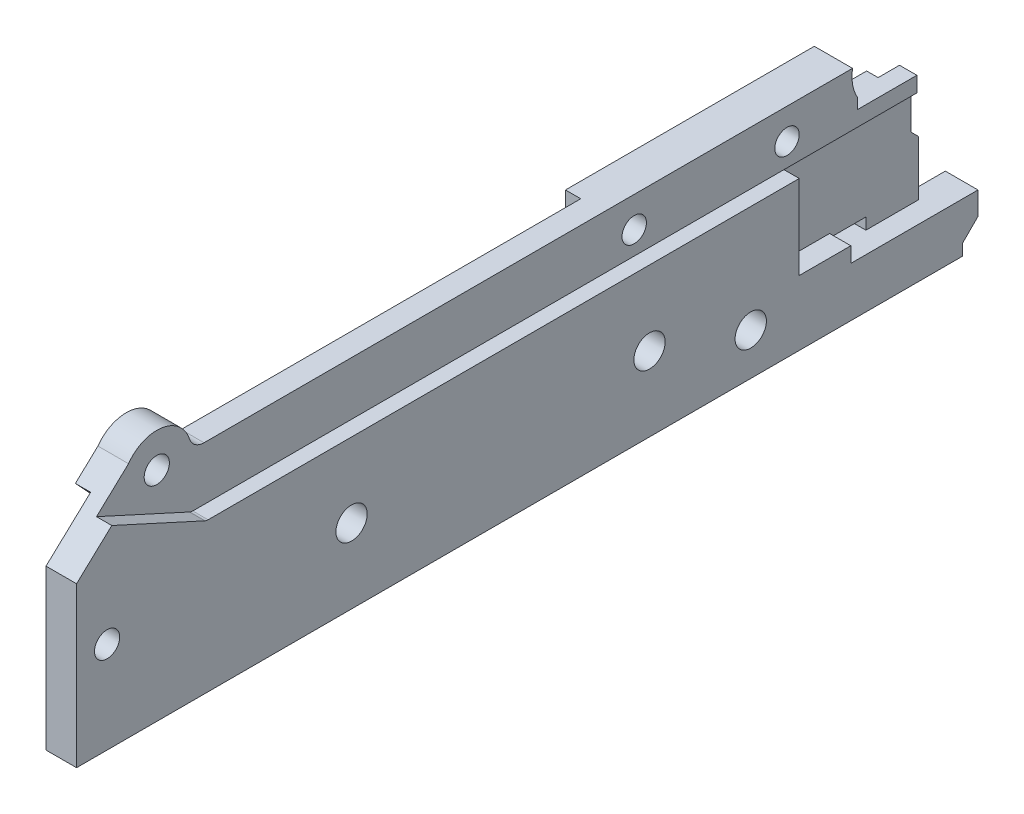
from build123d import *
from build123d.topology import SkipClean

# Parameters (mm, degrees)
SKETCH_1_R                       = 1.5999999999999999
SKETCH_1_R_2                     = 1.6000000000000016
EXTRUDE_1_DEPTH                  = 7
SKETCH_2_W                       = 33.199999999999996
SKETCH_2_H                       = 10.5
EXTRUDE_2_DEPTH                  = 2
EXTRUDE_3_DEPTH                  = 60
EXTRUDE_4_DEPTH                  = 38.5
SKETCH_5_W                       = 4.000000000000001
SKETCH_5_H                       = 10.499999999999998
EXTRUDE_5_DEPTH                  = 2
EXTRUDE_6_DEPTH                  = 19.5
EXTRUDE_7_DEPTH                  = 2
SKETCH_8_W                       = 93.19999999999999
SKETCH_8_H                       = 5
EXTRUDE_8_DEPTH                  = 3
SKETCH_10_W                      = 93.19999999999999
SKETCH_10_H                      = 1.9999999999999964
EXTRUDE_9_DEPTH                  = 5.5
SKETCH_12_W                      = 17.999999999999993
SKETCH_12_H                      = 1.9999999999999964
CUT_EXTRUDE_1_DEPTH              = 5.5
EXTRUDE_10_DEPTH                 = 3.5
CUT_EXTRUDE_2_REACH              = 70.879
EXTRUDE_12_DEPTH                 = 2
CUT_EXTRUDE_3_REACH              = 71.313
CHAMFER_1_SIZE                   = 3.5
SKETCH_18_R                      = 1.6500000000000001
EXTRUDE_13_DEPTH                 = 2
FILLET_1_R                       = 2
CUT_EXTRUDE_4_DEPTH              = 5
CHAMFER_2_SIZE                   = 3
CUT_EXTRUDE_5_REACH              = 74.561
SKETCH_20_R                      = 1.650000000000002
EXTRUDE_14_REACH                 = 73.895
SKETCH_21_R                      = 4.500000000000004
SKETCH_21_R_2                    = 1.6500000000000021
EXTRUDE_15_DEPTH                 = 6
EXTRUDE_16_DEPTH                 = 4
CUT_EXTRUDE_6_REACH              = 83.84
SKETCH_24_R                      = 1.6500000000000021
CUT_EXTRUDE_7_REACH              = 84.171
SKETCH_26_W                      = 1.9999999999999973
SKETCH_26_H                      = 10.5
CUT_EXTRUDE_8_DEPTH              = 5
SKETCH_27_W                      = 2.000000000000001
SKETCH_27_H                      = 1.9999999999999991
EXTRUDE_17_DEPTH                 = 10
CUT_EXTRUDE_9_DEPTH              = 2
CUT_EXTRUDE_10_REACH             = 84.426
SKETCH_29_R                      = 5.4999999999999964
SKETCH_30_W                      = 63
SKETCH_30_H                      = 2.000000000000001
EXTRUDE_18_DEPTH                 = 1
SKETCH_32_R                      = 1.6500000000000001
EXTRUDE_19_DEPTH                 = 0.775
EXTRUDE_20_DEPTH                 = 5.5
SKETCH_35_W                      = 4.9999999999999964
SKETCH_35_H                      = 9.999999999999998
CUT_EXTRUDE_12_DEPTH             = 1.225
EXTRUDE_21_DEPTH                 = 5
CUT_EXTRUDE_13_REACH             = 84.197
SKETCH_37_W                      = 4.75
SKETCH_37_H                      = 2.9999999999999982
CUT_EXTRUDE_13_DIRECTION_2_REACH = 84.197
CUT_EXTRUDE_14_REACH             = 84.197
CUT_EXTRUDE_14_DIRECTION_2_DEPTH = 1
EXTRUDE_22_DEPTH                 = 5.8
EXTRUDE_22_DIRECTION_2_REACH     = 116.063
SKETCH_40_W                      = 1.5000000000000004
SKETCH_40_H                      = 10
EXTRUDE_23_DEPTH                 = 5
CUT_EXTRUDE_15_REACH             = 84.085
SKETCH_41_W                      = 1
SKETCH_41_H                      = 7
CHAMFER_3_SIZE                   = 1
SKETCH_42_W                      = 2.775000000000003
SKETCH_42_H                      = 5.0000000000000036
EXTRUDE_24_DEPTH                 = 10.8
CUT_EXTRUDE_16_REACH             = 84.085
SKETCH_44_W                      = 9.799999999999997
SKETCH_44_H                      = 2.000000000000005
EXTRUDE_25_DEPTH                 = 2
SKETCH_45_W                      = 0.7999999999999972
SKETCH_45_H                      = 6.100000000000001
CUT_EXTRUDE_17_DEPTH             = 0.775
CUT_EXTRUDE_18_REACH             = 84.426
SKETCH_46_R                      = 2.0500000000000003
CUT_EXTRUDE_19_DEPTH             = 1
SKETCH_48_R                      = 2.0500000000000007
SKETCH_48_R_2                    = 2.0499999999999994
CUT_EXTRUDE_20_DEPTH             = 5
CUT_EXTRUDE_21_REACH             = 113.959
CUT_EXTRUDE_22_DEPTH             = 3
EXTRUDE_26_DEPTH                 = 14.5
EXTRUDE_27_DEPTH                 = 0.5
SKETCH_54_W                      = 28.68337520964458
SKETCH_54_H                      = 12.50000000000001
CUT_EXTRUDE_23_DEPTH             = 3
EXTRUDE_28_REACH                 = 83.879
FILLET_2_R                       = 0.8
EXTRUDE_START                    = -3.5
SKETCH_56_R                      = 3.999999999999999
SKETCH_56_R_2                    = 2.0500000000000007
EXTRUDE_29_DEPTH                 = 3.5
FILLET_3_R                       = 0.8
CUT_EXTRUDE_24_REACH             = 83.879
SKETCH_57_R                      = 2.0500000000000003
SKETCH_57_R_2                    = 2.0499999999999994
SKETCH_58_W                      = 15.200000000000006
SKETCH_58_H                      = 8.500000000000002
CUT_EXTRUDE_25_DEPTH             = 3.5
FILLET_4_R                       = 0.8
EXTRUDE_START_2                  = 0.5
EXTRUDE_30_DEPTH                 = 0.5
CUT_EXTRUDE_26_REACH             = 83.939
SKETCH_59_W                      = 2.600000000000005
SKETCH_59_H                      = 9.999999999999998
CUT_EXTRUDE_27_REACH             = 83.939
EXTRUDE_31_DEPTH                 = 1.5
EXTRUDE_32_DEPTH                 = 1.5
EXTRUDE_33_DEPTH                 = 1.5
SKETCH_64_W                      = 4.275000000000002
SKETCH_64_H                      = 5.0000000000000036
EXTRUDE_34_DEPTH                 = 5
CHAMFER_4_SIZE                   = 2
EXTRUDE_START_3                  = 1.5
SKETCH_65_R                      = 2.0499999999999994
SKETCH_65_R_2                    = 2.0500000000000043
EXTRUDE_35_DEPTH                 = 1.5
CUT_EXTRUDE_28_DEPTH             = 1
EXTRUDE_36_DEPTH                 = 1.5
CUT_EXTRUDE_29_REACH             = 76.844
EXTRUDE_37_REACH                 = 74.163
CUT_EXTRUDE_30_DEPTH             = 10
EXTRUDE_38_DEPTH                 = 0.5
CUT_EXTRUDE_START                = -36.378813151
CUT_EXTRUDE_31_OUTLINE_W         = 3
CUT_EXTRUDE_31_OUTLINE_H         = 5.999999999999998
CUT_EXTRUDE_31_DEPTH             = 0.35355339
FILLET_5_R                       = 1
CUT_EXTRUDE_START_2              = -101
CUT_EXTRUDE_32_DEPTH             = 87.2
CUT_EXTRUDE_33_REACH             = 80.404
CUT_EXTRUDE_34_DEPTH             = 1.225
CUT_EXTRUDE_START_3              = -2
CUT_EXTRUDE_35_DEPTH             = 2
FILLET_6_R                       = 1
CUT_EXTRUDE_36_REACH             = 80.462
CUT_EXTRUDE_36_DIRECTION_2_REACH = 80.462
FILLET_7_R                       = 2
SKETCH_79_W                      = 7.799999999999997
SKETCH_79_H                      = 2.0000000000000058
CUT_EXTRUDE_37_DEPTH             = 1.225


# Read off the part's stored shape, not the designer's step: 切除-拉伸31
# Some blends are built 0.0001 mm under size
with BuildPart() as part:
    # 草图1 → 凸台-拉伸1 (new body)
    with BuildSketch(Plane(origin=(0, 0, 0), x_dir=(0, 0, -1), z_dir=(1, 0, 0))):
        Polygon((29.2, 6.5), (-4, 6.4999999999999964), (-4.0000000000000036, -15.500000000000002), (29.200000000000003, -15.499999999999998), align=None)
        Circle(SKETCH_1_R, mode=Mode.SUBTRACT)
        with Locations((20, 0)):
            Circle(SKETCH_1_R_2, mode=Mode.SUBTRACT)
    extrude(amount=EXTRUDE_1_DEPTH)

    # 草图2 → 凸台-拉伸2 (add)
    with BuildSketch(Plane(origin=(7, 0, 0), x_dir=(0, 0, -1), z_dir=(1, 0, 0))):
        with Locations((12.599999999999998, 11.749999999999996)):
            Rectangle(SKETCH_2_W, SKETCH_2_H)
    extrude(amount=-EXTRUDE_2_DEPTH)

    # 草图3 → 凸台-拉伸3 (add)
    with BuildSketch(Plane.XY.offset(4.000000000000001)):
        Polygon((7, -15.500000000000002), (0.9999999999999998, -15.500000000000002), (0.9999999999999991, 4.4999999999999964), (2.999999999999999, 4.499999999999997), (3, 6.499999999999996), (7, 6.4999999999999964), align=None)
    extrude(amount=EXTRUDE_3_DEPTH)

    # 草图4 → 凸台-拉伸4 (add)
    with BuildSketch(Plane.XY.offset(4.000000000000001)):
        Polygon((4.999999999999997, 6.499999999999996), (7, 6.4999999999999964), (7, 16.999999999999996), (4.999999999999997, 16.999999999999996), align=None)
    extrude(amount=EXTRUDE_4_DEPTH)

    # 草图5 → 凸台-拉伸5 (add)
    with BuildSketch(Plane.XY.offset(42.5)):
        with Locations((5, 11.749999999999996)):
            Rectangle(SKETCH_5_W, SKETCH_5_H)
    extrude(amount=EXTRUDE_5_DEPTH)

    # 草图6 → 凸台-拉伸6 (add)
    with BuildSketch(Plane.XY.offset(44.50000000000001)):
        Polygon((7, 6.499999999999997), (7, 16.999999999999996), (3, 16.999999999999996), (3, 6.4999999999999964), align=None)
    extrude(amount=EXTRUDE_6_DEPTH)

    # 草图7 → 凸台-拉伸7 (add)
    with BuildSketch(Plane(origin=(0, 16.999999999999996, 0), x_dir=(1, 0, 0), z_dir=(0, 1, 0))):
        Polygon((7, 29.2), (0.9999999999999905, 29.2), (0.9999999999999991, -64), (7, -64), align=None)
    extrude(amount=EXTRUDE_7_DEPTH)

    # 草图8 → 凸台-拉伸8 (add)
    with BuildSketch(Plane.ZY.offset(-0.9999999999999933)):
        with Locations((17.400000000000002, 21.499999999999996)):
            Rectangle(SKETCH_8_W, SKETCH_8_H)
    extrude(amount=-EXTRUDE_8_DEPTH)

    # 草图10 → 凸台-拉伸9 (add)
    with BuildSketch(Plane.ZY.offset(-0.9999999999999933)):
        with Locations((17.400000000000002, 23)):
            Rectangle(SKETCH_10_W, SKETCH_10_H)
    extrude(amount=EXTRUDE_9_DEPTH)

    # 草图12 → 切除-拉伸1 (cut)
    with BuildSketch(Plane.ZY.offset(4.500000000000006)):
        with Locations((-20.2, 23)):
            Rectangle(SKETCH_12_W, SKETCH_12_H)
    extrude(amount=-CUT_EXTRUDE_1_DEPTH, mode=Mode.SUBTRACT)

    # 草图13 → 凸台-拉伸10 (add)
    with BuildSketch(Plane.ZY.offset(-0.9999999999999933)):
        Polygon((10.8, 22), (-29.2, 22), (-29.2, 16.999999999999996), (10.8, 17.000000000000004), align=None)
    extrude(amount=EXTRUDE_10_DEPTH)

    # 草图15 → 切除-拉伸2 (cut, up to next)
    with BuildSketch(Plane(origin=(3.9999999999999933, 0, -3.7e-16), x_dir=(-9e-17, 0, -1), z_dir=(1, 0, -9e-17)), mode=Mode.PRIVATE) as cut_extrude_2_sk1:
        Polygon((29.2, 23.999999999999996), (13.700000000000003, 23.999999999999993), (13.700000000000003, 18.999999999999996), (29.2, 18.999999999999996), align=None)
    cut_extrude_2_tool1 = extrude(cut_extrude_2_sk1.sketch, amount=-CUT_EXTRUDE_2_REACH, mode=Mode.PRIVATE) & part.part
    add(cut_extrude_2_tool1.solids().sort_by_distance((4, 21.5, -21.45))[0], mode=Mode.SUBTRACT)

    # 草图16 → 凸台-拉伸12 (add)
    with BuildSketch(Plane(origin=(0, 22, 0), x_dir=(1, 0, 0), z_dir=(0, 1, 0))):
        Polygon((0.9999999999999922, 11.200000000000001), (0.9999999999999922, 13.700000000000003), (-2.500000000000008, 13.700000000000003), (-2.5000000000000093, 11.200000000000001), align=None)
    extrude(amount=EXTRUDE_12_DEPTH)

    # 草图17 → 切除-拉伸3 (cut, up to next)
    with BuildSketch(Plane(origin=(7, 0, 0), x_dir=(0, 0, -1), z_dir=(1, 0, 0)), mode=Mode.PRIVATE) as cut_extrude_3_sk1:
        Polygon((-47.5, 24), (-64, 8.61350107872841), (-64, 23.999999999999996), align=None)
    cut_extrude_3_tool1 = extrude(cut_extrude_3_sk1.sketch, amount=-CUT_EXTRUDE_3_REACH, mode=Mode.PRIVATE) & part.part
    add(cut_extrude_3_tool1.solids().sort_by_distance((7, 18.871167, 58.5))[0], mode=Mode.SUBTRACT)

    # 倒角1
    # the kernel refuses this chamfer: 3.5 mm, written as the material it takes off along each edge
    with BuildSketch(Plane(origin=(-4.500000000000002, 15.861407468623153, 56.227571974289006), x_dir=(0.9996219169112969, 0.020109211138415985, 0.018752142756900524), z_dir=(0, 0.6819983600625026, -0.7313537016191667))) as chamfer_1_piece_1:
        Polygon((CHAMFER_1_SIZE * 0.999621916911, CHAMFER_1_SIZE * 0.0274958766106), (-CHAMFER_1_SIZE * 0.0274958766106, CHAMFER_1_SIZE * 0.999621916911), (0, 0), align=None)
    extrude(amount=20.93433928704058, mode=Mode.SUBTRACT)

    # 草图18 → 凸台-拉伸13 (add)
    with BuildSketch(Plane.ZY.offset(2.5000000000000067)):
        with BuildLine():
            Line((-11.337000000000002, 27.199999999999996), (-11.337000000000002, 23.999999999999996))
            Line((-11.337000000000002, 23.999999999999996), (-13.700000000000003, 23.999999999999996))
            Line((-13.700000000000003, 23.999999999999996), (-13.700000000000003, 18.999999999999996))
            Line((-13.700000000000003, 18.999999999999996), (-21.337000000000003, 18.999999999999996))
            Line((-21.337000000000003, 18.999999999999996), (-21.337000000000003, 27.199999999999996))
            ThreePointArc((-21.337000000000003, 27.199999999999996), (-16.337, 32.199999999999996), (-11.337000000000002, 27.199999999999996))
        make_face()
        with Locations((-16.337, 27.199999999999996)):
            Circle(SKETCH_18_R, mode=Mode.SUBTRACT)
    extrude(amount=-EXTRUDE_13_DEPTH)

    # 圆角1
    fillet_1_edges = [part.edges().sort_by_distance(p)[0] for p in [
        (-1.5000000000000075, 23.999999999999996, -11.337000000000002),
        (-1.5000000000000089, 18.999999999999996, -21.337000000000003),
    ]]
    fillet(fillet_1_edges, radius=FILLET_1_R)

    # 草图19 → 切除-拉伸4 (cut)
    with BuildSketch(Plane(origin=(0, 23.999999999999996, 0), x_dir=(1, 0, 0), z_dir=(0, 1, 0))):
        Polygon((3.9999999999999925, 13.700000000000003), (-0.5000000000000078, 13.700000000000003), (-0.5000000000000078, -7.800000000000002), (3.9999999999999947, -7.800000000000002), align=None)
    extrude(amount=-CUT_EXTRUDE_4_DEPTH, mode=Mode.SUBTRACT)

    # 倒角2
    chamfer_2_edges = [part.edges().sort_by_distance(p)[0] for p in [
        (3.999999999999996, 23.999999999999996, 27.650000000000006),
        (0.9999999999999961, 22, 30.222368710024668),
    ]]
    chamfer(chamfer_2_edges, length=CHAMFER_2_SIZE)

    # 草图20 → 切除-拉伸5 (cut, up to next)
    with BuildSketch(Plane(origin=(7, 0, 0), x_dir=(0, 0, -1), z_dir=(1, 0, 0)), mode=Mode.PRIVATE) as cut_extrude_5_sk1:
        with Locations((-62.5, 3.9999999999999982)):
            Circle(SKETCH_20_R)
    cut_extrude_5_tool1 = extrude(cut_extrude_5_sk1.sketch, amount=-CUT_EXTRUDE_5_REACH, mode=Mode.PRIVATE) & part.part
    add(cut_extrude_5_tool1.solids().sort_by_distance((7, 4, 62.5))[0], mode=Mode.SUBTRACT)

    # 凸台-拉伸14: up to this face of the body (flat: up to its plane)
    extrude_14_end = Plane(part.part.faces().sort_by_distance((7, 1.498387626, 16.627822956))[0])
    # 草图21 → 凸台-拉伸14 (add, up to the picked face)
    with BuildSketch(Plane.ZY.offset(-0.9999999999999993), mode=Mode.PRIVATE) as extrude_14_sk1:
        with Locations((62.5, 3.9999999999999982)):
            Circle(SKETCH_21_R)
        with Locations(Location((62.5, 3.9999999999999982, 0), (0, 0, 180))):
            Circle(SKETCH_21_R_2, mode=Mode.SUBTRACT)
    extrude_14_tool1 = split(extrude(extrude_14_sk1.sketch, amount=-EXTRUDE_14_REACH, mode=Mode.PRIVATE), bisect_by=extrude_14_end, keep=Keep.BOTH, mode=Mode.PRIVATE)
    add(extrude_14_tool1.solids().sort_by(Axis((1, 4, 58.127279), (1, 3e-17, 0)))[0])

    # 草图22 → 凸台-拉伸15 (add)
    with BuildSketch(Plane.ZY.offset(-0.9999999999999993)):
        with BuildLine():
            Line((66.19859520899438, 6.563277878031139), (75, -1.644164868785978))
            Line((75, -1.644164868785978), (75, -15.500000000000002))
            Line((75, -15.500000000000002), (64, -15.500000000000002))
            Line((64, -15.500000000000002), (64, -0.24264068711929174))
            ThreePointArc((64, -0.24264068711929174), (66.78211161877054, 2.616699568282301), (66.19859520899438, 6.563277878031139))
        make_face()
    extrude(amount=-EXTRUDE_15_DEPTH)

    # 草图23 → 凸台-拉伸16 (add)
    with BuildSketch(Plane(origin=(7, 0, 0), x_dir=(0, 0, -1), z_dir=(1, 0, 0))):
        Polygon((-64, 8.61350107872841), (-64.79903290236383, 7.8683908429537635), (-64, 8.24264068711929), align=None)
    extrude(amount=-EXTRUDE_16_DEPTH)

    # 草图24 → 切除-拉伸6 (cut, up to next)
    with BuildSketch(Plane.ZY.offset(-0.9999999999999993), mode=Mode.PRIVATE) as cut_extrude_6_sk1:
        with Locations(Location((71, -10.500000000000002, 0), (0, 0, 270))):
            Circle(SKETCH_24_R)
    cut_extrude_6_tool1 = extrude(cut_extrude_6_sk1.sketch, amount=-CUT_EXTRUDE_6_REACH, mode=Mode.PRIVATE) & part.part
    add(cut_extrude_6_tool1.solids().sort_by_distance((1, -10.5, 71))[0], mode=Mode.SUBTRACT)

    # 草图25 → 切除-拉伸7 (cut, up to next)
    with BuildSketch(Plane.ZY.offset(-5), mode=Mode.PRIVATE) as cut_extrude_7_sk1:
        with BuildLine():
            Line((17.8, 7.9999999999999964), (-14.200000000000003, 7.999999999999993))
            ThreePointArc((-14.200000000000003, 7.999999999999993), (-17.95, 11.749999999999996), (-14.200000000000005, 15.499999999999993))
            Line((-14.200000000000005, 15.499999999999993), (17.8, 15.499999999999996))
            ThreePointArc((17.8, 15.499999999999996), (21.550000000000004, 11.749999999999996), (17.8, 7.9999999999999964))
        make_face()
    cut_extrude_7_tool1 = extrude(cut_extrude_7_sk1.sketch, amount=-CUT_EXTRUDE_7_REACH, mode=Mode.PRIVATE) & part.part
    add(cut_extrude_7_tool1.solids().sort_by_distance((5, 11.75, 1.8))[0], mode=Mode.SUBTRACT)

    # 草图26 → 切除-拉伸8 (cut)
    with BuildSketch(Plane(origin=(0, 0, 42.5), x_dir=(-1, 0, 0), z_dir=(0, 0, -1))):
        with Locations((-3.9999999999999987, 11.749999999999996)):
            Rectangle(SKETCH_26_W, SKETCH_26_H)
    extrude(amount=-CUT_EXTRUDE_8_DEPTH, mode=Mode.SUBTRACT)

    # 草图27 → 凸台-拉伸17 (add)
    with BuildSketch(Plane.XY.offset(4.000000000000001)):
        with Locations((1.9999999999999996, 5.4999999999999964)):
            Rectangle(SKETCH_27_W, SKETCH_27_H)
    extrude(amount=EXTRUDE_17_DEPTH)

    # 草图28 → 切除-拉伸9 (cut)
    with BuildSketch(Plane.ZY.offset(-0.9999999999999993)):
        Polygon((67, 1.4942632669129565), (67, -15.500000000000002), (75, -15.500000000000002), (75, -1.644164868785978), (69.15558256377493, 3.8058425601799555), align=None)
    extrude(amount=-CUT_EXTRUDE_9_DEPTH, mode=Mode.SUBTRACT)

    # 草图29 → 切除-拉伸10 (cut, up to next)
    with BuildSketch(Plane(origin=(7, 0, 0), x_dir=(0, 0, -1), z_dir=(1, 0, 0)), mode=Mode.PRIVATE) as cut_extrude_10_sk1:
        with Locations((34, 3.1)):
            Circle(SKETCH_29_R)
    cut_extrude_10_tool1 = extrude(cut_extrude_10_sk1.sketch, amount=-CUT_EXTRUDE_10_REACH, mode=Mode.PRIVATE) & part.part
    add(cut_extrude_10_tool1.solids().sort_by_distance((7, 3.1, -34))[0], mode=Mode.SUBTRACT)

    # 草图30 → 凸台-拉伸18 (add)
    with BuildSketch(Plane.ZY.offset(-0.9999999999999993)):
        with Locations((35.5, -5.5)):
            Rectangle(SKETCH_30_W, SKETCH_30_H)
    extrude(amount=EXTRUDE_18_DEPTH)

    # 草图32 → 凸台-拉伸19 (add)
    with BuildSketch(Plane.ZY.offset(2.5000000000000067)):
        with BuildLine():
            Line((-11.200000000000001, 22), (-11.200000000000001, 25.272517354158875))
            ThreePointArc((-11.200000000000001, 25.272517354158875), (-11.30245160204977, 25.62986488953356), (-11.337000000000002, 25.999999999999996))
            Line((-11.337000000000002, 25.999999999999996), (-11.337000000000002, 27.199999999999996))
            ThreePointArc((-11.337000000000002, 27.199999999999996), (-16.337, 32.199999999999996), (-21.337000000000003, 27.199999999999996))
            Line((-21.337000000000003, 27.199999999999996), (-21.337000000000003, 20.999999999999996))
            ThreePointArc((-21.337000000000003, 20.999999999999996), (-21.922786437626907, 19.5857864376269), (-23.337000000000003, 18.999999999999996))
            Line((-23.337000000000003, 18.999999999999996), (-29.2, 18.999999999999996))
            Line((-29.2, 18.999999999999996), (-29.2, 16.999999999999996))
            Line((-29.2, 16.999999999999996), (10.8, 17.000000000000004))
            Line((10.8, 17.000000000000004), (10.8, 22))
            Line((10.8, 22), (-11.200000000000001, 22))
        make_face()
        with Locations((-16.337, 27.199999999999996)):
            Circle(SKETCH_32_R, mode=Mode.SUBTRACT)
    extrude(amount=EXTRUDE_19_DEPTH)

    # 草图34 → 凸台-拉伸20 (add)
    with BuildSketch(Plane.XZ.offset(15.500000000000002)):
        Polygon((3.000000000000006, 75), (3, 67), (0.9999999999999998, 67), (1, 4.000000000000005), (0, 4.000000000000005), (0, -29.200000000000003), (7, -29.200000000000003), (6.999999999999999, 75), align=None)
    extrude(amount=EXTRUDE_20_DEPTH)

    # 草图35 → 切除-拉伸12 (cut)
    with BuildSketch(Plane.ZY):
        with Locations((-26.700000000000003, -15.999999999999996)):
            Rectangle(SKETCH_35_W, SKETCH_35_H)
    extrude(amount=-CUT_EXTRUDE_12_DEPTH, mode=Mode.SUBTRACT)

    # 草图36 → 凸台-拉伸21 (add)
    with BuildSketch(Plane(origin=(0, 4.6e-15, -29.2), x_dir=(-1, 0, 0), z_dir=(0, 1.6e-16, -1))):
        Polygon((-1.225, -21), (-5.2250000000000005, -21), (-5.2250000000000005, -11.000000000000002), (-1.225, -11), align=None)
    extrude(amount=EXTRUDE_21_DEPTH)

    # 草图37 → 切除-拉伸13 (cut, up to next)
    with BuildSketch(Plane(origin=(5.2250000000000005, 0, 0), x_dir=(0, 0, -1), z_dir=(1, 0, 0)), mode=Mode.PRIVATE) as cut_extrude_13_sk1:
        with Locations((31.225, -14.499999999999996)):
            Rectangle(SKETCH_37_W, SKETCH_37_H)
    cut_extrude_13_tool1 = extrude(cut_extrude_13_sk1.sketch, amount=-CUT_EXTRUDE_13_REACH, mode=Mode.PRIVATE) & part.part
    add(cut_extrude_13_tool1.solids().sort_by_distance((5.225, -14.5, -31.225))[0], mode=Mode.SUBTRACT)

    # 草图37 → 切除-拉伸13 direction 2 (cut, up to next)
    with BuildSketch(Plane(origin=(5.2250000000000005, 0, 0), x_dir=(0, 0, -1), z_dir=(1, 0, 0)), mode=Mode.PRIVATE) as cut_extrude_13_direction_2_sk1:
        with Locations((31.225, -14.499999999999996)):
            Rectangle(SKETCH_37_W, SKETCH_37_H)
    cut_extrude_13_direction_2_tool1 = extrude(cut_extrude_13_direction_2_sk1.sketch, amount=CUT_EXTRUDE_13_DIRECTION_2_REACH, mode=Mode.PRIVATE) & part.part
    add(cut_extrude_13_direction_2_tool1.solids().sort_by_distance((5.225, -14.5, -31.225))[0], mode=Mode.SUBTRACT)

    # 草图38 → 切除-拉伸14 (cut, up to next)
    with BuildSketch(Plane(origin=(5.2250000000000005, 0, 0), x_dir=(0, 0, -1), z_dir=(1, 0, 0)), mode=Mode.PRIVATE) as cut_extrude_14_sk1:
        Polygon((34.2, -13.999999999999996), (19.599999999999998, -13.999999999999998), (19.599999999999998, -3.000000000000001), (34.2, -2.9999999999999973), align=None)
    cut_extrude_14_tool1 = extrude(cut_extrude_14_sk1.sketch, amount=CUT_EXTRUDE_14_REACH, mode=Mode.PRIVATE) & part.part
    add(cut_extrude_14_tool1.solids().sort_by_distance((5.225, -8.5, -26.9))[0], mode=Mode.SUBTRACT)

    # 草图38 → 切除-拉伸14 direction 2 (cut)
    with BuildSketch(Plane(origin=(5.2250000000000005, 0, 0), x_dir=(0, 0, -1), z_dir=(1, 0, 0))):
        Polygon((34.2, -13.999999999999996), (19.599999999999998, -13.999999999999998), (19.599999999999998, -3.000000000000001), (34.2, -2.9999999999999973), align=None)
    extrude(amount=-CUT_EXTRUDE_14_DIRECTION_2_DEPTH, mode=Mode.SUBTRACT)

    # 草图39 → 凸台-拉伸22 (add)
    with BuildSketch(Plane(origin=(0, 0, -34.2), x_dir=(-1, 0, 0), z_dir=(0, 0, -1))):
        Polygon((-2.7250000000000005, -0.9999999999999941), (-4.2250000000000005, -0.9999999999999941), (-4.224999999999998, -20.999999999999996), (-2.724999999999999, -20.999999999999996), align=None)
    extrude(amount=EXTRUDE_22_DEPTH)

    # 草图39 → 凸台-拉伸22 direction 2 (add, up to next)
    with BuildSketch(Plane(origin=(0, 0, -34.2), x_dir=(-1, 0, 0), z_dir=(0, 0, -1)), mode=Mode.PRIVATE) as extrude_22_direction_2_sk1:
        Polygon((-2.7250000000000005, -0.9999999999999941), (-4.2250000000000005, -0.9999999999999941), (-4.224999999999998, -20.999999999999996), (-2.724999999999999, -20.999999999999996), align=None)
    extrude_22_direction_2_tool1 = extrude(extrude_22_direction_2_sk1.sketch, amount=-EXTRUDE_22_DIRECTION_2_REACH, mode=Mode.PRIVATE) - part.part
    add(extrude_22_direction_2_tool1.solids().sort_by_distance((3.475, -11, -34.2))[0])

    # 草图40 → 凸台-拉伸23 (add)
    with BuildSketch(Plane(origin=(0, 4.6e-15, -29.2), x_dir=(-1, 0, 0), z_dir=(0, 1.6e-16, -1))):
        with Locations((-1.9750000000000003, -6)):
            Rectangle(SKETCH_40_W, SKETCH_40_H)
    extrude(amount=EXTRUDE_23_DEPTH)

    # 草图41 → 切除-拉伸15 (cut, up to next)
    with BuildSketch(Plane(origin=(4.2250000000000005, 0, 0), x_dir=(0, 0, -1), z_dir=(1, 0, 0)), mode=Mode.PRIVATE) as cut_extrude_15_sk1:
        with Locations((39.5, -4.499999999999994)):
            Rectangle(SKETCH_41_W, SKETCH_41_H)
    cut_extrude_15_tool1 = extrude(cut_extrude_15_sk1.sketch, amount=-CUT_EXTRUDE_15_REACH, mode=Mode.PRIVATE) & part.part
    add(cut_extrude_15_tool1.solids().sort_by_distance((4.225, -4.5, -39.5))[0], mode=Mode.SUBTRACT)

    # 倒角3
    chamfer_3_edges = [part.edges().sort_by_distance(p)[0] for p in [
        (3.475, -7.999999999999995, -39),
    ]]
    chamfer(chamfer_3_edges, length=CHAMFER_3_SIZE - 0.0001)  # a hair under: the kernel refuses the full size

    # 草图42 → 凸台-拉伸24 (add)
    with BuildSketch(Plane(origin=(0, 4.6e-15, -29.2), x_dir=(-1, 0, 0), z_dir=(0, 1.6e-16, -1))):
        with Locations((-5.612499999999999, -18.5)):
            Rectangle(SKETCH_42_W, SKETCH_42_H)
    extrude(amount=EXTRUDE_24_DEPTH)

    # 草图43 → 切除-拉伸16 (cut, up to next)
    with BuildSketch(Plane(origin=(4.2250000000000005, 0, 0), x_dir=(0, 0, -1), z_dir=(1, 0, 0)), mode=Mode.PRIVATE) as cut_extrude_16_sk1:
        Polygon((33.6, -15.999999999999996), (34.2, -15.999999999999993), (34.2, -13.999999999999996), (33.6, -13.999999999999996), align=None)
    cut_extrude_16_tool1 = extrude(cut_extrude_16_sk1.sketch, amount=CUT_EXTRUDE_16_REACH, mode=Mode.PRIVATE) & part.part
    add(cut_extrude_16_tool1.solids().sort_by_distance((4.225, -15, -33.9))[0], mode=Mode.SUBTRACT)

    # 草图44 → 凸台-拉伸25 (add)
    with BuildSketch(Plane(origin=(4.2250000000000005, 0, 0), x_dir=(0, 0, -1), z_dir=(1, 0, 0))):
        with Locations((34.1, -1.9999999999999967)):
            Rectangle(SKETCH_44_W, SKETCH_44_H)
    extrude(amount=EXTRUDE_25_DEPTH)

    # 草图45 → 切除-拉伸17 (cut)
    with BuildSketch(Plane(origin=(7, 0, 0), x_dir=(0, 0, -1), z_dir=(1, 0, 0))):
        with Locations((28.900000000000002, 0.05000000000000049)):
            Rectangle(SKETCH_45_W, SKETCH_45_H)
    extrude(amount=-CUT_EXTRUDE_17_DEPTH, mode=Mode.SUBTRACT)

    # 草图46 → 切除-拉伸18 (cut, up to next)
    with BuildSketch(Plane(origin=(7, 0, 0), x_dir=(0, 0, -1), z_dir=(1, 0, 0)), mode=Mode.PRIVATE) as cut_extrude_18_sk1:
        with Locations((13.250000000000002, -17)):
            Circle(SKETCH_46_R)
    cut_extrude_18_tool1 = extrude(cut_extrude_18_sk1.sketch, amount=-CUT_EXTRUDE_18_REACH, mode=Mode.PRIVATE) & part.part
    add(cut_extrude_18_tool1.solids().sort_by_distance((7, -17, -13.25))[0], mode=Mode.SUBTRACT)

    # 草图47 → 切除-拉伸19 (cut)
    with BuildSketch(Plane.ZY.offset(-0.9999999999999993)):
        with BuildLine():
            Line((62.5, -0.5000000000000066), (67, -0.5000000000000066))
            Line((67, -0.5000000000000066), (67, -4.5))
            Line((67, -4.5), (4, -4.5))
            Line((4, -4.5), (4.000000000000001, 6.4999999999999964))
            Line((4.000000000000001, 6.4999999999999964), (14.000000000000002, 6.4999999999999964))
            Line((14.000000000000002, 6.4999999999999964), (14.000000000000002, 4.499999999999997))
            Line((14.000000000000002, 4.499999999999997), (58.02786404500042, 4.499999999999997))
            ThreePointArc((58.02786404500042, 4.499999999999997), (59.14589803375031, 0.9999999999999978), (62.5, -0.5000000000000066))
        make_face()
    extrude(amount=-CUT_EXTRUDE_19_DEPTH, mode=Mode.SUBTRACT)

    # 草图48 → 切除-拉伸20 (cut)
    with BuildSketch(Plane.XZ.offset(20.999999999999993)):
        with Locations(Location((3.5, 57.99999999999999, 0), (0, 0, 270))):
            Circle(SKETCH_48_R)
        with Locations(Location((3.499999999999995, 19.999999999999996, 0), (0, 0, 270))):
            Circle(SKETCH_48_R_2)
        with Locations(Location((3.5000000000000004, -18.000000000000004, 0), (0, 0, 270))):
            Circle(SKETCH_48_R_2)
    extrude(amount=-CUT_EXTRUDE_20_DEPTH, mode=Mode.SUBTRACT)

    # 草图50 → 切除-拉伸21 (cut, up to next)
    with BuildSketch(Plane.XY.offset(67), mode=Mode.PRIVATE) as cut_extrude_21_sk1:
        Polygon((0, -21), (0, -3.4999999999999996), (0.49999999999999784, -3.4999999999999996), (0.5, -21), align=None)
    cut_extrude_21_tool1 = extrude(cut_extrude_21_sk1.sketch, amount=-CUT_EXTRUDE_21_REACH, mode=Mode.PRIVATE) & part.part
    add(cut_extrude_21_tool1.solids().sort_by_distance((0.25, -12.25, 67))[0], mode=Mode.SUBTRACT)

    # 草图51 → 切除-拉伸22 (cut)
    with BuildSketch(Plane(origin=(0, 0, -28.85), x_dir=(-1, 0, 0), z_dir=(0, 0, -1))):
        Polygon((-4.2250000000000005, -13.999999999999996), (-7, -13.999999999999996), (-7, -15.999999999999996), (-1.2250000000000003, -15.999999999999996), (-1.2250000000000003, -12.999999999999998), (-4.2250000000000005, -12.999999999999998), align=None)
    extrude(amount=-CUT_EXTRUDE_22_DEPTH, mode=Mode.SUBTRACT)

    # 草图52 → 凸台-拉伸26 (add)
    with BuildSketch(Plane.XZ.offset(20.999999999999993)):
        with BuildLine():
            Line((0.9999999999999996, 59.658312395177695), (0.9999999999999996, 56.3416876048223))
            ThreePointArc((0.9999999999999996, 56.3416876048223), (0.4999999999999982, 57.99999999999999), (0.9999999999999996, 59.658312395177695))
        make_face()
        with BuildLine():
            Line((1, 21.658312395177706), (1, 18.341687604822287))
            ThreePointArc((1, 18.341687604822287), (0.4999999999999938, 19.999999999999996), (1, 21.658312395177706))
        make_face()
    extrude(amount=-EXTRUDE_26_DEPTH)

    # 草图53 → 凸台-拉伸27 (add)
    with BuildSketch(Plane.ZY.offset(-0.9999999999999993)):
        Polygon((4.000000000000003, -21), (4.000000000000003, -19.000000000000004), (18.341687604822283, -19.000000000000004), (18.341687604822283, -6.499999999999999), (21.658312395177706, -6.499999999999999), (21.658312395177706, -19.000000000000004), (56.34168760482229, -19.000000000000004), (56.34168760482229, -6.499999999999999), (59.65831239517769, -6.499999999999999), (59.65831239517769, -19.000000000000004), (66, -19.000000000000004), (66, -6.5), (67, -6.5), (67, -19.000000000000004), (67, -21), align=None)
    extrude(amount=EXTRUDE_27_DEPTH)

    # 草图54 → 切除-拉伸23 (cut)
    with BuildSketch(Plane.ZY.offset(-0.9999999999999993)):
        with Locations((38.99999999999999, -12.750000000000005)):
            Rectangle(SKETCH_54_W, SKETCH_54_H)
        Polygon((4, -6.5), (15.341687604822285, -6.499999999999999), (15.341687604822285, -19.000000000000004), (4, -19.000000000000004), align=None)
    extrude(amount=-CUT_EXTRUDE_23_DEPTH, mode=Mode.SUBTRACT)

    # 草图55 → 凸台-拉伸28 (add, up to next)
    with BuildSketch(Plane.ZY.offset(-0.4999999999999974), mode=Mode.PRIVATE) as extrude_28_sk1:
        Polygon((4.000000000000003, -18.336739033708813), (17.580705078500625, -6.5), (18.341687604822283, -6.499999999999999), (18.341687604822283, -7.163260966291187), (4.7609825263216665, -19.000000000000004), (4.000000000000003, -19.000000000000004), align=None)
    extrude_28_tool1 = extrude(extrude_28_sk1.sketch, amount=-EXTRUDE_28_REACH, mode=Mode.PRIVATE) - part.part
    # 草图55 → 凸台-拉伸28 (add, up to next)
    with BuildSketch(Plane.ZY.offset(-0.4999999999999974), mode=Mode.PRIVATE) as extrude_28_sk2:
        Polygon((23.132998268675106, -6.499999999999999), (39, -12.218518467211013), (54.86700173132489, -6.499999999999999), (56.34168760482229, -6.499999999999999), (56.34168760482229, -7.031481532788984), (40.47468587349739, -12.75), (56.34168760482229, -18.468518467211016), (56.34168760482229, -19.000000000000004), (54.86700173132492, -19.00000000000001), (38.99999999999999, -13.281481532788987), (23.13299826867507, -19.00000000000001), (21.658312395177706, -19.000000000000004), (21.658312395177706, -18.46851846721102), (37.52531412650261, -12.750000000000002), (21.658312395177706, -7.0314815327889875), (21.658312395177706, -6.499999999999999), align=None)
    extrude_28_tool2 = extrude(extrude_28_sk2.sketch, amount=-EXTRUDE_28_REACH, mode=Mode.PRIVATE) - part.part
    # 草图55 → 凸台-拉伸28 (add, up to next)
    with BuildSketch(Plane.ZY.offset(-0.4999999999999974), mode=Mode.PRIVATE) as extrude_28_sk3:
        Polygon((59.65831239517769, -7.60512134795183), (65.43933325166955, -19.00000000000001), (66, -19.000000000000004), (66, -17.894878652048163), (60.21897914350814, -6.499999999999999), (59.65831239517769, -6.499999999999999), align=None)
    extrude_28_tool3 = extrude(extrude_28_sk3.sketch, amount=-EXTRUDE_28_REACH, mode=Mode.PRIVATE) - part.part
    add(extrude_28_tool1.solids().sort_by_distance((0.5, -12.75, 11.170844))[0])
    add(extrude_28_tool2.solids().sort_by_distance((0.5, -12.75, 39))[0])
    add(extrude_28_tool3.solids().sort_by_distance((0.5, -12.75, 62.829156))[0])

    # 圆角2
    fillet_2_edges = [part.edges().sort_by_distance(p)[0] for p in [
        (0.75, -19.000000000000004, 18.341687604822283),
        (2.5, -19.000000000000004, 15.341687604822285),
        (2.4999999999999996, -6.499999999999999, 15.341687604822285),
        (2.2499999999999987, -6.5, 4),
        (0.7499999999999991, -7.163260966291187, 18.341687604822283),
        (0.7499999999999989, -6.5, 17.580705078500625),
        (2.5, -9.778016009999636, 15.341687604822285),
        (2.4999999999999996, -8.451494077417262, 15.341687604822287),
        (2.2499999999999996, -18.336739033708813, 4.000000000000003),
        (2.2499999999999996, -19.000000000000004, 4.7609825263216665),
        (2.249999999999999, -12.750000000000002, 37.52531412650261),
        (2.249999999999999, -13.281481532788987, 38.99999999999999),
        (2.249999999999999, -12.218518467211013, 39),
        (2.249999999999999, -12.75, 40.47468587349739),
        (2.4999999999999996, -8.112691183618246, 53.34168760482229),
        (2.5, -17.387308816381754, 53.34168760482229),
        (0.7499999999999991, -18.468518467211016, 56.34168760482229),
        (0.7499999999999984, -7.031481532788984, 56.34168760482229),
        (0.7499999999999989, -6.499999999999999, 54.86700173132489),
        (0.7499999999999998, -19.00000000000001, 54.86700173132492),
        (0.7499999999999998, -19.00000000000001, 23.13299826867507),
        (0.7499999999999989, -6.499999999999999, 23.132998268675106),
        (0.7499999999999998, -18.46851846721102, 21.658312395177706),
        (0.7499999999999991, -7.0314815327889875, 21.658312395177706),
        (0.7499999999999998, -17.894878652048163, 66),
        (0.75, -19.000000000000004, 59.65831239517769),
        (0.7499999999999998, -19.00000000000001, 65.43933325166955),
        (0.7499999999999996, -6.5, 66),
        (0.7499999999999989, -6.499999999999999, 60.21897914350814),
        (0.7499999999999993, -7.60512134795183, 59.65831239517769),
    ]]
    fillet(fillet_2_edges, radius=FILLET_2_R)

    # 草图56 → 凸台-拉伸29 (add)
    with BuildSketch(Plane.ZY.offset(-0.4999999999999974).offset(EXTRUDE_START)):
        with Locations((39, -12.75)):
            Circle(SKETCH_56_R)
        with Locations((39, -12.75)):
            Circle(SKETCH_56_R_2, mode=Mode.SUBTRACT)
    extrude(amount=EXTRUDE_29_DEPTH)

    # 圆角3
    fillet_3_edges = [part.edges().sort_by_distance(p)[0] for p in [
        (2.249999999999999, -14.565967071780634, 35.43597648798321),
        (2.249999999999999, -14.565967071780637, 42.56402351201679),
        (2.249999999999999, -10.934032928219365, 42.56402351201679),
        (2.249999999999999, -10.934032928219366, 35.43597648798321),
        (2.249999999999999, -11.874799387923458, 42.9030787704863),
        (2.249999999999999, -13.625200612076544, 42.9030787704863),
        (2.249999999999999, -13.625200612076545, 35.0969212295137),
        (2.249999999999999, -11.87479938792346, 35.0969212295137),
    ]]
    fillet(fillet_3_edges, radius=FILLET_3_R)

    # 草图57 → 切除-拉伸24 (cut, up to next)
    with BuildSketch(Plane.ZY.offset(-0.4999999999999974), mode=Mode.PRIVATE) as cut_extrude_24_sk1:
        with Locations(Location((39, -12.75, 0), (0, 0, 270))):
            Circle(SKETCH_57_R)
    cut_extrude_24_tool1 = extrude(cut_extrude_24_sk1.sketch, amount=-CUT_EXTRUDE_24_REACH, mode=Mode.PRIVATE) & part.part
    # 草图57 → 切除-拉伸24 (cut, up to next)
    with BuildSketch(Plane.ZY.offset(-0.4999999999999974), mode=Mode.PRIVATE) as cut_extrude_24_sk2:
        with Locations(Location((0, -12.75, 0), (0, 0, 270))):
            Circle(SKETCH_57_R_2)
    cut_extrude_24_tool2 = extrude(cut_extrude_24_sk2.sketch, amount=-CUT_EXTRUDE_24_REACH, mode=Mode.PRIVATE) & part.part
    add(cut_extrude_24_tool1.solids().sort_by_distance((0.5, -12.75, 39))[0], mode=Mode.SUBTRACT)
    add(cut_extrude_24_tool2.solids().sort_by_distance((0.5, -12.75, 0))[0], mode=Mode.SUBTRACT)

    # 草图58 → 切除-拉伸25 (cut)
    with SkipClean():  # the faces are left unmerged after this step: merging them gives an invalid solid
        with BuildSketch(Plane.ZY.offset(-0.4999999999999974)):
            with Locations((-11.600000000000003, -8.75)):
                Rectangle(SKETCH_58_W, SKETCH_58_H)
        extrude(amount=-CUT_EXTRUDE_25_DEPTH, mode=Mode.SUBTRACT)

    # 圆角4
    fillet_4_edges = [part.edges().sort_by_distance(p)[0] for p in [
        (2.249999999999999, -13.000000000000002, -19.200000000000006),
        (2.249999999999998, -4.5, -19.200000000000006),
        (2.249999999999998, -4.5, -4),
        (2.249999999999999, -13.000000000000002, -4),
    ]]
    fillet(fillet_4_edges, radius=FILLET_4_R)

    # 草图31 → 凸台-拉伸30 (add)
    with SkipClean():  # the faces are left unmerged after this step: merging them gives an invalid solid
        with BuildSketch(Plane.ZY.offset(-5).offset(EXTRUDE_START_2)):
            Polygon((-29.2, 6.5), (47.5, 6.4999999999999964), (47.5, 16.999999999999996), (-29.2, 16.999999999999996), align=None)
            with BuildLine():
                Line((-14.200000000000003, 7.999999999999993), (17.8, 7.9999999999999964))
                ThreePointArc((17.8, 7.9999999999999964), (21.550000000000004, 11.749999999999996), (17.8, 15.499999999999996))
                Line((17.8, 15.499999999999996), (-14.200000000000005, 15.499999999999996))
                ThreePointArc((-14.200000000000005, 15.499999999999996), (-17.950000000000003, 11.749999999999996), (-14.200000000000003, 7.999999999999993))
            make_face(mode=Mode.SUBTRACT)
        extrude(amount=-EXTRUDE_30_DEPTH)

    # 草图59 → 切除-拉伸26 (cut, up to next)
    with BuildSketch(Plane.ZY.offset(-2.7250000000000005), mode=Mode.PRIVATE) as cut_extrude_26_sk1:
        with Locations((-32.9, -15.999999999999996)):
            Rectangle(SKETCH_59_W, SKETCH_59_H)
    cut_extrude_26_tool1 = extrude(cut_extrude_26_sk1.sketch, amount=CUT_EXTRUDE_26_REACH, mode=Mode.PRIVATE) & part.part
    add(cut_extrude_26_tool1.solids().sort_by_distance((2.725, -16, -32.9))[0], mode=Mode.SUBTRACT)

    # 草图60 → 切除-拉伸27 (cut, up to next)
    with BuildSketch(Plane.ZY.offset(-2.7250000000000005), mode=Mode.PRIVATE) as cut_extrude_27_sk1:
        Polygon((-37, -0.999999999999994), (-37, -7.828427124746205), (-38, -8.828427124746192), (-38, -20.999999999999996), (-40, -20.999999999999996), (-40, -7.999999999999995), (-39, -7.000000000000008), (-39, -0.999999999999994), align=None)
    cut_extrude_27_tool1 = extrude(cut_extrude_27_sk1.sketch, amount=-CUT_EXTRUDE_27_REACH, mode=Mode.PRIVATE) & part.part
    add(cut_extrude_27_tool1.solids().sort_by_distance((2.725, -10.937388, -38.651159))[0], mode=Mode.SUBTRACT)

    # 草图61 → 凸台-拉伸31 (add)
    with SkipClean():  # the faces are left unmerged after this step: merging them gives an invalid solid
        with BuildSketch(Plane(origin=(4.2250000000000005, 0, 0), x_dir=(0, 0, -1), z_dir=(1, 0, 0))):
            Polygon((32.599999999999994, -15.999999999999993), (32.599999999999994, -14.499999999999996), (27.35, -14.499999999999996), (27.35, -15.999999999999993), (25.85, -15.999999999999996), (25.85, -12.999999999999998), (33.6, -12.999999999999998), (33.6, -15.999999999999996), align=None)
        extrude(amount=-EXTRUDE_31_DEPTH)

    # 草图62 → 凸台-拉伸32 (add)
    with SkipClean():  # the faces are left unmerged after this step: merging them gives an invalid solid
        with BuildSketch(Plane(origin=(0, 0, -25.85), x_dir=(-1, 0, 0), z_dir=(0, 0, -1))):
            Polygon((-4.2250000000000005, -15.999999999999996), (-4.2250000000000005, -13.999999999999998), (-7, -13.999999999999996), (-7, -15.999999999999996), align=None)
        extrude(amount=EXTRUDE_32_DEPTH)

    # 草图63 → 凸台-拉伸33 (add)
    with SkipClean():  # the faces are left unmerged after this step: merging them gives an invalid solid
        with BuildSketch(Plane.ZY.offset(-2.7250000000000005)):
            Polygon((-31.599999999999998, -12.999999999999998), (-31.599999999999998, -14.499999999999996), (-27.35, -14.499999999999996), (-27.35, -15.999999999999996), (-25.85, -15.999999999999996), (-25.85, -12.999999999999998), align=None)
        extrude(amount=EXTRUDE_33_DEPTH)

    # 草图64 → 凸台-拉伸34 (add)
    with SkipClean():  # the faces are left unmerged after this step: merging them gives an invalid solid
        with BuildSketch(Plane(origin=(0, 0, -38), x_dir=(-1, 0, 0), z_dir=(0, 0, -1))):
            with Locations((-4.8625, -18.499999999999993)):
                Rectangle(SKETCH_64_W, SKETCH_64_H)
        extrude(amount=EXTRUDE_34_DEPTH)

    # 倒角4
    chamfer_4_edges = [part.edges().sort_by_distance(p)[0] for p in [
        (4.862499999999999, -20.999999999999996, -43),
    ]]
    chamfer(chamfer_4_edges, length=CHAMFER_4_SIZE)

    # 草图65 → 凸台-拉伸35 (add)
    with BuildSketch(Plane.XZ.offset(20.999999999999993).offset(EXTRUDE_START_3)):
        Polygon((2.724999999999999, -31.59999999999999), (2.724999999999999, -40.999999999999986), (7, -40.999999999999986), (6.999999999999999, 75), (3.000000000000006, 75), (3, 67), (0.5000000000000023, 67), (0.5, -24.200000000000003), (1.225, -24.200000000000003), (1.225, -31.59999999999999), align=None)
        with Locations(Location((3.5000000000000004, -18.000000000000004, 0), (0, 0, 270))):
            Circle(SKETCH_65_R, mode=Mode.SUBTRACT)
        with Locations(Location((3.499999999999995, 19.999999999999996, 0), (0, 0, 270))):
            Circle(SKETCH_65_R, mode=Mode.SUBTRACT)
        with Locations(Location((3.5, 57.99999999999999, 0), (0, 0, 270))):
            Circle(SKETCH_65_R_2, mode=Mode.SUBTRACT)
    extrude(amount=-EXTRUDE_35_DEPTH)

    # 草图66 → 切除-拉伸28 (cut)
    with BuildSketch(Plane(origin=(0, 0, -27.35), x_dir=(-1, 0, 0), z_dir=(0, 0, -1))):
        Polygon((-7, -15.999999999999996), (-1.2250000000000003, -15.999999999999996), (-1.2250000000000003, -14.499999999999996), (-4.2250000000000005, -14.499999999999996), (-4.2250000000000005, -13.999999999999996), (-7, -13.999999999999996), align=None)
    extrude(amount=-CUT_EXTRUDE_28_DEPTH, mode=Mode.SUBTRACT)

    # 草图67 → 凸台-拉伸36 (add)
    with BuildSketch(Plane.XY.offset(-32.599999999999994)):
        Polygon((4.2250000000000005, -14.499999999999996), (2.724999999999999, -14.499999999999996), (2.724999999999999, -15.999999999999996), (4.225, -15.999999999999996), align=None)
    extrude(amount=EXTRUDE_36_DEPTH)

    # 切除-拉伸29: up to this plane
    cut_extrude_29_end = Plane(origin=(-4.501000000000007, 24, 47.5), z_dir=(0, -0.7313537016191667, -0.6819983600625026))
    # 草图68 → 切除-拉伸29 (cut, up to the surface)
    with BuildSketch(Plane(origin=(0, 0, 7.800000000000002), x_dir=(-1, 0, 0), z_dir=(0, 0, -1)), mode=Mode.PRIVATE) as cut_extrude_29_sk1:
        Polygon((-0.9999999999999913, 23.999999999999996), (-3.9999999999999947, 20.999999999999993), (-0.9999999999999913, 20.999999999999993), align=None)
    cut_extrude_29_tool1 = split(extrude(cut_extrude_29_sk1.sketch, amount=-CUT_EXTRUDE_29_REACH, mode=Mode.PRIVATE), bisect_by=cut_extrude_29_end, keep=Keep.BOTH, mode=Mode.PRIVATE)
    add(cut_extrude_29_tool1.solids().sort_by_distance((2, 22, 7.8))[0], mode=Mode.SUBTRACT)

    # 凸台-拉伸37: up to this plane
    extrude_37_end = Plane(origin=(-4.501000000000007, 24, 47.5), z_dir=(0, -0.7313537016191667, -0.6819983600625026))
    # 草图69 → 凸台-拉伸37 (add, up to the surface)
    with BuildSketch(Plane.XY.offset(10.8), mode=Mode.PRIVATE) as extrude_37_sk1:
        Polygon((-2.000000000000018, 22), (0.9999999999999968, 19.00000000000001), (-1.9999999999999931, 19.00000000000001), align=None)
    extrude_37_tool1 = split(extrude(extrude_37_sk1.sketch, amount=EXTRUDE_37_REACH, mode=Mode.PRIVATE), bisect_by=extrude_37_end, keep=Keep.BOTH, mode=Mode.PRIVATE)
    add(extrude_37_tool1.solids().sort_by_distance((-1, 20, 10.8))[0])

    # 草图70 → 切除-拉伸30 (cut, along a direction that is not the sketch's normal)
    with BuildSketch(Plane(origin=(0, 23.999999999999996, 0), x_dir=(1, 0, 0), z_dir=(0, 1, 0))):
        Polygon((-4.500000000000003, -42.368022850261255), (-4.500000000000003, -52.86184355012334), (-0.9999999999999792, -52.86184355012334), (-0.9999999999999792, -47.5), align=None)
    extrude(amount=-CUT_EXTRUDE_30_DEPTH, dir=(0, 0.6819983600625026, -0.7313537016191667), mode=Mode.SUBTRACT)

    # 草图71 → 凸台-拉伸38 (add)
    with BuildSketch(Plane.ZY.offset(4.500000000000006)):
        with BuildLine():
            Line((-11.200000000000001, 22), (44.51276027031061, 22))
            Line((44.51276027031061, 22), (42.368022850261255, 23.999999999999996))
            Line((42.368022850261255, 23.999999999999996), (-9.337000000000002, 23.999999999999996))
            ThreePointArc((-9.337000000000002, 23.999999999999996), (-10.465059109337307, 24.348490797530594), (-11.200000000000001, 25.272517354158875))
            Line((-11.200000000000001, 25.272517354158875), (-11.200000000000001, 22))
        make_face()
    extrude(amount=EXTRUDE_38_DEPTH)

    # 切除-拉伸31 outline → 切除-拉伸31 (cut)
    with BuildSketch(Plane(origin=(0, 0, 0), x_dir=(0.7071067811865441, 0.5171451618607982, 0.4822456651583028), z_dir=(0.707106781186551, -0.5171451618607931, -0.48224566515829803)).offset(CUT_EXTRUDE_START)):
        with Locations((29.500000000000004, 16)):
            Rectangle(CUT_EXTRUDE_31_OUTLINE_W, CUT_EXTRUDE_31_OUTLINE_H)
    extrude(amount=CUT_EXTRUDE_31_DEPTH, mode=Mode.SUBTRACT)

    # 圆角5
    fillet_5_edges = [part.edges().sort_by_distance(p)[0] for p in [
        (2.5, -17.38730881638176, 24.658312395177706),
        (2.4999999999999996, -8.112691183618246, 24.658312395177706),
    ]]
    fillet(fillet_5_edges, radius=FILLET_5_R)

    # 草图73 → 切除-拉伸32 (cut)
    with BuildSketch(Plane(origin=(0, 0, -43), x_dir=(-1, 0, 0), z_dir=(0, 0, -1)).offset(CUT_EXTRUDE_START_2)):
        Polygon((-7, -2.9999999999999987), (-6.2250000000000005, -3), (-6.2250000000000005, 4), (0, 4), (0, 16.999999999999996), (7.1372172795908515, 16.999999999999996), (7.1372172795908515, 36.05293466319409), (-7, 36.05293466319409), align=None)
    extrude(amount=CUT_EXTRUDE_32_DEPTH, mode=Mode.SUBTRACT)

    # 草图74 → 切除-拉伸33 (cut, up to next)
    with BuildSketch(Plane.ZY.offset(-2.999999999999997), mode=Mode.PRIVATE) as cut_extrude_33_sk1:
        with BuildLine():
            Line((57.99999999999999, 14.208591595554449), (57.99999999999999, 4.5))
            Line((57.99999999999999, 4.5), (58.02786404500042, 4.5))
            ThreePointArc((58.02786404500042, 4.5), (60.49572745439464, 8.029006274868859), (64.79903290236383, 7.868390842953767))
            Line((64.79903290236383, 7.868390842953767), (57.99999999999999, 14.208591595554449))
        make_face()
    cut_extrude_33_tool1 = extrude(cut_extrude_33_sk1.sketch, amount=-CUT_EXTRUDE_33_REACH, mode=Mode.PRIVATE) & part.part
    add(cut_extrude_33_tool1.solids().sort_by_distance((3, 9.807544, 59.882382))[0], mode=Mode.SUBTRACT)

    # 草图75 → 切除-拉伸34 (cut)
    with BuildSketch(Plane(origin=(6.2250000000000005, 0, 0), x_dir=(0, 0, -1), z_dir=(1, 0, 0))):
        with BuildLine():
            Line((29.200000000000003, -0.9999999999999941), (29.200000000000003, -3))
            Line((29.200000000000003, -3), (19.59999999999999, -3))
            Line((19.59999999999999, -3), (-57.99999999999999, -3))
            Line((-57.99999999999999, -3), (-57.99999999999999, 4))
            Line((-57.99999999999999, 4), (28.574136013499793, 4.000000000000001))
            ThreePointArc((28.574136013499793, 4.000000000000001), (28.581938676058638, 2.154160959776616), (29.2, 0.41485568358049996))
            Line((29.2, 0.41485568358049996), (29.200000000000003, -0.9999999999999941))
        make_face()
    extrude(amount=-CUT_EXTRUDE_34_DEPTH, mode=Mode.SUBTRACT)

    # 草图76 → 切除-拉伸35 (cut)
    with BuildSketch(Plane(origin=(7, 0, 0), x_dir=(0, 0, -1), z_dir=(1, 0, 0)).offset(CUT_EXTRUDE_START_3)):
        with BuildLine():
            Line((-57.99999999999999, -2.9999999999999987), (-64.3682310469314, -0.09386281588447729))
            Line((-64.3682310469314, -0.09386281588447729), (-70.39040537556122, 2.654351659482303))
            Line((-70.39040537556122, 2.654351659482303), (-66.19859520899438, 6.563277878031141))
            ThreePointArc((-66.19859520899438, 6.563277878031141), (-61.15718177709615, 8.294978372499369), (-58, 3.9999999999999982))
            Line((-58, 3.9999999999999982), (-57.99999999999999, -2.9999999999999987))
        make_face()
    extrude(amount=CUT_EXTRUDE_35_DEPTH, mode=Mode.SUBTRACT)

    # 圆角6
    fillet_6_edges = [part.edges().sort_by_distance(p)[0] for p in [
        (6, -2.999999999999999, 58),
    ]]
    fillet(fillet_6_edges, radius=FILLET_6_R)

    # 草图77 → 切除-拉伸36 (cut, up to next)
    with BuildSketch(Plane(origin=(5, 0, 0), x_dir=(0, 0, -1), z_dir=(1, 0, 0)), mode=Mode.PRIVATE) as cut_extrude_36_sk1:
        with BuildLine():
            Line((-58, 3.9999999999999982), (-56.5, 4.000000000000001))
            Line((-56.5, 4.000000000000001), (-56.5, 8.499999999999996))
            Line((-56.5, 8.499999999999996), (-62.5, 8.499999999999996))
            ThreePointArc((-62.5, 8.499999999999996), (-59.31801948466054, 7.181980515339462), (-58, 3.9999999999999982))
        make_face()
    cut_extrude_36_tool1 = extrude(cut_extrude_36_sk1.sketch, amount=-CUT_EXTRUDE_36_REACH, mode=Mode.PRIVATE) & part.part
    add(cut_extrude_36_tool1.solids().sort_by_distance((5, 6.73755, 57.937416))[0], mode=Mode.SUBTRACT)

    # 草图77 → 切除-拉伸36 direction 2 (cut, up to next)
    with BuildSketch(Plane(origin=(5, 0, 0), x_dir=(0, 0, -1), z_dir=(1, 0, 0)), mode=Mode.PRIVATE) as cut_extrude_36_direction_2_sk1:
        with BuildLine():
            Line((-58, 3.9999999999999982), (-56.5, 4.000000000000001))
            Line((-56.5, 4.000000000000001), (-56.5, 8.499999999999996))
            Line((-56.5, 8.499999999999996), (-62.5, 8.499999999999996))
            ThreePointArc((-62.5, 8.499999999999996), (-59.31801948466054, 7.181980515339462), (-58, 3.9999999999999982))
        make_face()
    cut_extrude_36_direction_2_tool1 = extrude(cut_extrude_36_direction_2_sk1.sketch, amount=CUT_EXTRUDE_36_DIRECTION_2_REACH, mode=Mode.PRIVATE) & part.part
    add(cut_extrude_36_direction_2_tool1.solids().sort_by_distance((5, 6.73755, 57.937416))[0], mode=Mode.SUBTRACT)

    # 圆角7
    fillet_7_edges = [part.edges().sort_by_distance(p)[0] for p in [
        (3.4999999999999996, 4, 58),
    ]]
    fillet(fillet_7_edges, radius=FILLET_7_R)

    # 草图79 → 切除-拉伸37 (cut)
    with BuildSketch(Plane(origin=(6.2250000000000005, 0, 0), x_dir=(0, 0, -1), z_dir=(1, 0, 0))):
        with Locations((33.1, -1.9999999999999971)):
            Rectangle(SKETCH_79_W, SKETCH_79_H)
    extrude(amount=-CUT_EXTRUDE_37_DEPTH, mode=Mode.SUBTRACT)


solid = part.part
